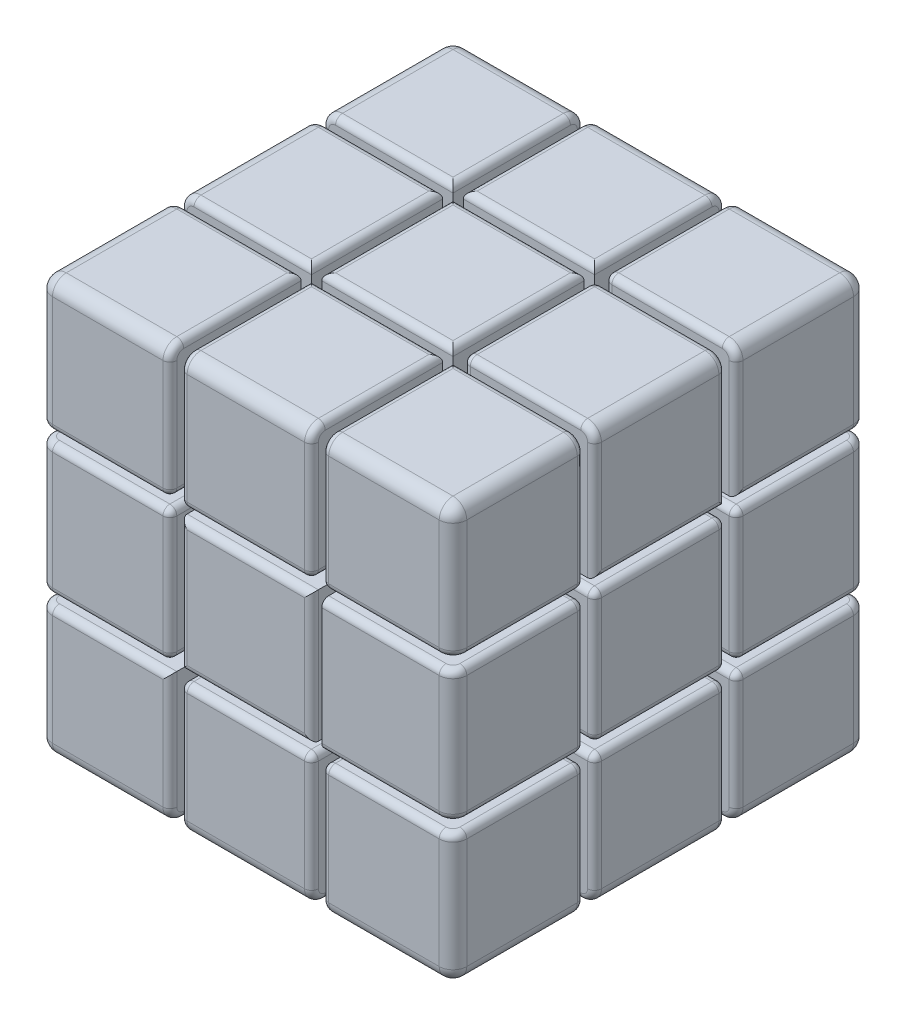
from build123d import *

# Parameters (mm, degrees)
SKETCH1_W           = 60
SKETCH1_H           = 60
BOSS_EXTRUDE1_DEPTH = 60
SKETCH2_W           = 1.5
SKETCH2_H           = 60
SKETCH2_W_2         = 60
SKETCH2_H_2         = 1.5
CUT_EXTRUDE1_DEPTH  = 60
SKETCH3_W           = 1.5
SKETCH3_H           = 60
CUT_EXTRUDE2_DEPTH  = 60
FILLET1_R           = 2
FILLET2_R           = 2
FILLET3_R           = 2
FILLET4_R           = 2
FILLET5_R           = 2
FILLET6_R           = 2
FILLET7_R           = 2
FILLET8_R           = 2
FILLET9_R           = 2
FILLET10_R          = 2
FILLET11_R          = 2
FILLET12_R          = 2
FILLET13_R          = 2
FILLET14_R          = 2
FILLET15_R          = 2
FILLET16_R          = 2
FILLET17_R          = 2
FILLET18_R          = 2
FILLET19_R          = 2
FILLET20_R          = 2
FILLET21_R          = 1
FILLET22_R          = 1
FILLET23_R          = 1
FILLET24_R          = 1
FILLET25_R          = 1
FILLET26_R          = 1
FILLET27_R          = 1
FILLET28_R          = 1
FILLET29_R          = 1
FILLET30_R          = 1
FILLET31_R          = 1
FILLET32_R          = 1
FILLET33_R          = 1
FILLET34_R          = 1
FILLET35_R          = 1
FILLET36_R          = 1
FILLET37_R          = 1
FILLET38_R          = 1
FILLET39_R          = 1
FILLET40_R          = 1
FILLET41_R          = 1
FILLET42_R          = 1
FILLET43_R          = 1
FILLET44_R          = 1
FILLET45_R          = 1
FILLET46_R          = 1
FILLET47_R          = 1
FILLET48_R          = 1
FILLET49_R          = 1
FILLET50_R          = 1
FILLET51_R          = 1
FILLET52_R          = 1
FILLET53_R          = 1
FILLET54_R          = 1
FILLET55_R          = 1
FILLET56_R          = 1
FILLET57_R          = 1
FILLET58_R          = 1
FILLET59_R          = 1
FILLET60_R          = 1
FILLET61_R          = 1
FILLET62_R          = 1
FILLET63_R          = 1
FILLET64_R          = 1
FILLET65_R          = 1
FILLET66_R          = 1
FILLET67_R          = 1
FILLET68_R          = 1
FILLET69_R          = 1
FILLET70_R          = 1
FILLET71_R          = 1
FILLET72_R          = 1
FILLET73_R          = 1


with BuildPart() as part:
    # Sketch1 → Boss-Extrude1 (new body)
    with BuildSketch(Plane(origin=(0, 0, 0), x_dir=(1, 0, 0), z_dir=(0, 1, 0))):
        Rectangle(SKETCH1_W, SKETCH1_H)
    extrude(amount=BOSS_EXTRUDE1_DEPTH)

    # Sketch2 → Cut-Extrude1 (cut)
    with BuildSketch(Plane.XY.offset(30)):
        with Locations((-10.25, 30)):
            Rectangle(SKETCH2_W, SKETCH2_H)
        with Locations((10.25, 30)):
            Rectangle(SKETCH2_W, SKETCH2_H)
        with Locations((0, 40.25)):
            Rectangle(SKETCH2_W_2, SKETCH2_H_2)
        with Locations((0, 19.75)):
            Rectangle(SKETCH2_W_2, SKETCH2_H_2)
    extrude(amount=-CUT_EXTRUDE1_DEPTH, mode=Mode.SUBTRACT)


with BuildPart() as cut_extrude1_piece_1:
    # of the separate pieces the step leaves, piece 1, a body of its own (cut_extrude1_pieces)
    add(part.part.solids().sort_by_distance((-9.5, 60, -30))[0])


with BuildPart() as cut_extrude1_piece_2:
    # of the separate pieces the step leaves, piece 2, a body of its own (cut_extrude1_pieces)
    add(part.part.solids().sort_by_distance((-9.5, 0, -30))[0])


with BuildPart() as cut_extrude1_piece_3:
    # of the separate pieces the step leaves, piece 3, a body of its own (cut_extrude1_pieces)
    add(part.part.solids().sort_by_distance((-30, 41, -30))[0])


with BuildPart() as cut_extrude1_piece_4:
    # of the separate pieces the step leaves, piece 4, a body of its own (cut_extrude1_pieces)
    add(part.part.solids().sort_by_distance((-30, 0, -30))[0])


with BuildPart() as cut_extrude1_piece_5:
    # of the separate pieces the step leaves, piece 5, a body of its own (cut_extrude1_pieces)
    add(part.part.solids().sort_by_distance((11, 60, -30))[0])


with BuildPart() as cut_extrude1_piece_6:
    # of the separate pieces the step leaves, piece 6, a body of its own (cut_extrude1_pieces)
    add(part.part.solids().sort_by_distance((-9.5, 39.5, -30))[0])


with BuildPart() as cut_extrude1_piece_7:
    # of the separate pieces the step leaves, piece 7, a body of its own (cut_extrude1_pieces)
    add(part.part.solids().sort_by_distance((11, 0, -30))[0])


with BuildPart() as cut_extrude1_piece_8:
    # of the separate pieces the step leaves, piece 8, a body of its own (cut_extrude1_pieces)
    add(part.part.solids().sort_by_distance((-30, 20.5, -30))[0])


with BuildPart() as cut_extrude1_piece_9:
    # of the separate pieces the step leaves, piece 9, a body of its own (cut_extrude1_pieces)
    add(part.part.solids().sort_by_distance((30, 20.5, -30))[0])


with BuildPart() as cut_extrude2_tool:
    # Sketch3 → Cut-Extrude2 (new body)
    with BuildSketch(Plane(origin=(30, 0, 0), x_dir=(0, 0, -1), z_dir=(1, 0, 0))):
        with Locations((-10.25, 30)):
            Rectangle(SKETCH3_W, SKETCH3_H)
        with Locations((10.25, 30)):
            Rectangle(SKETCH3_W, SKETCH3_H)
    extrude(amount=-CUT_EXTRUDE2_DEPTH)


with BuildPart() as cut_extrude1_piece_1_1:
    add(cut_extrude1_piece_1.part)

    # Cut-Extrude2: cut by cut_extrude2_tool
    add(cut_extrude2_tool.part, mode=Mode.SUBTRACT)

    # Fillet4
    fillet4_edges = [cut_extrude1_piece_1_1.edges().sort_by_distance(p)[0] for p in [
        (0, 60, 30),
    ]]
    fillet(fillet4_edges, radius=FILLET4_R)

    # Fillet20
    fillet20_edges = [cut_extrude1_piece_1_1.edges().sort_by_distance(p)[0] for p in [
        (0, 60, -30),
    ]]
    fillet(fillet20_edges, radius=FILLET20_R)

    # Fillet35
    fillet35_edges = [cut_extrude1_piece_1_1.edges().sort_by_distance(p)[0] for p in [
        (-9.5, 60, 0),
        (0, 60, -9.5),
        (9.5, 60, 0),
        (0, 60, 9.5),
    ]]
    fillet(fillet35_edges, radius=FILLET35_R)

    # Fillet38
    fillet38_edges = [cut_extrude1_piece_1_1.edges().sort_by_distance(p)[0] for p in [
        (9.5, 49.5, 30),
        (9.5, 59.414213562, 29.414213562),
        (-9.5, 49.5, 30),
        (-9.5, 59.414213562, 29.414213562),
        (9.5, 60, 19.5),
        (-9.5, 60, 19.5),
        (0, 60, 11),
    ]]
    fillet(fillet38_edges, radius=FILLET38_R)

    # Fillet42
    fillet42_edges = [cut_extrude1_piece_1_1.edges().sort_by_distance(p)[0] for p in [
        (9.5, 49.5, -30),
        (9.5, 59.414213562, -29.414213562),
        (-9.5, 49.5, -30),
        (-9.5, 59.414213562, -29.414213562),
        (9.5, 60, -19.5),
        (0, 60, -11),
        (-9.5, 60, -19.5),
    ]]
    fillet(fillet42_edges, radius=FILLET42_R)

    # Fillet50
    fillet50_edges = [cut_extrude1_piece_1_1.edges().sort_by_distance(p)[0] for p in [
        (-9.5, 41, -20),
        (-9.207106781, 41, -29.707106781),
        (9.5, 41, -20),
        (9.207106781, 41, -29.707106781),
        (0, 41, -30),
    ]]
    fillet(fillet50_edges, radius=FILLET50_R)

    # Fillet57
    fillet57_edges = [cut_extrude1_piece_1_1.edges().sort_by_distance(p)[0] for p in [
        (-9.5, 41, 20),
        (-9.207106781, 41, 29.707106781),
        (9.5, 41, 20),
        (9.207106781, 41, 29.707106781),
        (0, 41, 30),
    ]]
    fillet(fillet57_edges, radius=FILLET57_R)


with BuildPart() as cut_extrude1_piece_2_1:
    add(cut_extrude1_piece_2.part)

    # Cut-Extrude2: cut by cut_extrude2_tool
    add(cut_extrude2_tool.part, mode=Mode.SUBTRACT)

    # Fillet8
    fillet8_edges = [cut_extrude1_piece_2_1.edges().sort_by_distance(p)[0] for p in [
        (0, 0, 30),
    ]]
    fillet(fillet8_edges, radius=FILLET8_R)

    # Fillet14
    fillet14_edges = [cut_extrude1_piece_2_1.edges().sort_by_distance(p)[0] for p in [
        (0, 0, -30),
    ]]
    fillet(fillet14_edges, radius=FILLET14_R)

    # Fillet46
    fillet46_edges = [cut_extrude1_piece_2_1.edges().sort_by_distance(p)[0] for p in [
        (-9.5, 0, -19.5),
        (-9.5, 0.585786438, -29.414213562),
        (9.5, 0, -19.5),
        (9.5, 0.585786438, -29.414213562),
        (-9.5, 10.5, -30),
        (0, 19, -30),
        (9.5, 10.5, -30),
    ]]
    fillet(fillet46_edges, radius=FILLET46_R)

    # Fillet65
    fillet65_edges = [cut_extrude1_piece_2_1.edges().sort_by_distance(p)[0] for p in [
        (0, 0, -9.5),
        (-9.5, 0, 0),
        (0, 0, 9.5),
        (9.5, 0, 0),
    ]]
    fillet(fillet65_edges, radius=FILLET65_R)

    # Fillet68
    fillet68_edges = [cut_extrude1_piece_2_1.edges().sort_by_distance(p)[0] for p in [
        (-9.5, 10, -11),
        (-9.207106781, 0.292893219, -11),
        (9.5, 10, -11),
        (9.207106781, 0.292893219, -11),
        (0, 0, -11),
    ]]
    fillet(fillet68_edges, radius=FILLET68_R)

    # Fillet70
    fillet70_edges = [cut_extrude1_piece_2_1.edges().sort_by_distance(p)[0] for p in [
        (-9.5, 10.5, 30),
        (-9.5, 0.585786438, 29.414213562),
        (9.5, 10.5, 30),
        (9.5, 0.585786438, 29.414213562),
        (0, 0, 11),
        (-9.5, 0, 19.5),
        (9.5, 0, 19.5),
    ]]
    fillet(fillet70_edges, radius=FILLET70_R)

    # Fillet71
    fillet71_edges = [cut_extrude1_piece_2_1.edges().sort_by_distance(p)[0] for p in [
        (-9.5, 19, 20),
        (-9.207106781, 19, 29.707106781),
        (9.5, 19, 20),
        (9.207106781, 19, 29.707106781),
        (0, 19, 30),
    ]]
    fillet(fillet71_edges, radius=FILLET71_R)


with BuildPart() as cut_extrude1_piece_3_1:
    add(cut_extrude1_piece_3.part)

    # Cut-Extrude2: cut by cut_extrude2_tool
    add(cut_extrude2_tool.part, mode=Mode.SUBTRACT)

    # Fillet5
    fillet5_edges = [cut_extrude1_piece_3_1.edges().sort_by_distance(p)[0] for p in [
        (-30, 60, 20.5),
        (-30, 50.5, 30),
        (-20.5, 60, 30),
    ]]
    fillet(fillet5_edges, radius=FILLET5_R)

    # Fillet9
    fillet9_edges = [cut_extrude1_piece_3_1.edges().sort_by_distance(p)[0] for p in [
        (-30, 60, 0),
    ]]
    fillet(fillet9_edges, radius=FILLET9_R)

    # Fillet10
    fillet10_edges = [cut_extrude1_piece_3_1.edges().sort_by_distance(p)[0] for p in [
        (-20.5, 60, -30),
        (-30, 50.5, -30),
        (-30, 60, -20.5),
    ]]
    fillet(fillet10_edges, radius=FILLET10_R)

    # Fillet39
    fillet39_edges = [cut_extrude1_piece_3_1.edges().sort_by_distance(p)[0] for p in [
        (-30, 49.5, 11),
        (-29.414213562, 59.414213562, 11),
        (-11, 49.5, 30),
        (-11, 59.414213562, 29.414213562),
        (-19.5, 60, 11),
        (-11, 60, 19.5),
    ]]
    fillet(fillet39_edges, radius=FILLET39_R)

    # Fillet40
    fillet40_edges = [cut_extrude1_piece_3_1.edges().sort_by_distance(p)[0] for p in [
        (-30, 49.5, -9.5),
        (-29.414213562, 59.414213562, -9.5),
        (-30, 49.5, 9.5),
        (-29.414213562, 59.414213562, 9.5),
        (-19.5, 60, -9.5),
        (-19.5, 60, 9.5),
        (-11, 60, 0),
    ]]
    fillet(fillet40_edges, radius=FILLET40_R)

    # Fillet41
    fillet41_edges = [cut_extrude1_piece_3_1.edges().sort_by_distance(p)[0] for p in [
        (-30, 49.5, -11),
        (-29.414213562, 59.414213562, -11),
        (-11, 49.5, -30),
        (-11, 59.414213562, -29.414213562),
        (-19.5, 60, -11),
        (-11, 60, -19.5),
    ]]
    fillet(fillet41_edges, radius=FILLET41_R)

    # Fillet51
    fillet51_edges = [cut_extrude1_piece_3_1.edges().sort_by_distance(p)[0] for p in [
        (-20, 41, -11),
        (-29.707106781, 41, -11.292893219),
        (-30, 41, -20),
        (-29.414213562, 41, -29.414213562),
        (-11, 41, -20),
        (-11.292893219, 41, -29.707106781),
        (-20, 41, -30),
    ]]
    fillet(fillet51_edges, radius=FILLET51_R)

    # Fillet54
    fillet54_edges = [cut_extrude1_piece_3_1.edges().sort_by_distance(p)[0] for p in [
        (-20, 41, 11),
        (-29.707106781, 41, 11.292893219),
        (-30, 41, 20),
        (-29.414213562, 41, 29.414213562),
        (-11, 41, 20),
        (-11.292893219, 41, 29.707106781),
        (-20, 41, 30),
    ]]
    fillet(fillet54_edges, radius=FILLET54_R)

    # Fillet62
    fillet62_edges = [cut_extrude1_piece_3_1.edges().sort_by_distance(p)[0] for p in [
        (-20, 41, -9.5),
        (-29.707106781, 41, -9.207106781),
        (-20, 41, 9.5),
        (-29.707106781, 41, 9.207106781),
        (-30, 41, 0),
    ]]
    fillet(fillet62_edges, radius=FILLET62_R)


with BuildPart() as cut_extrude1_piece_4_1:
    add(cut_extrude1_piece_4.part)

    # Cut-Extrude2: cut by cut_extrude2_tool
    add(cut_extrude2_tool.part, mode=Mode.SUBTRACT)

    # Fillet6
    fillet6_edges = [cut_extrude1_piece_4_1.edges().sort_by_distance(p)[0] for p in [
        (-20.5, 0, 30),
        (-30, 0, 20.5),
        (-30, 9.5, 30),
    ]]
    fillet(fillet6_edges, radius=FILLET6_R)

    # Fillet12
    fillet12_edges = [cut_extrude1_piece_4_1.edges().sort_by_distance(p)[0] for p in [
        (-30, 0, -20.5),
        (-20.5, 0, -30),
        (-30, 9.5, -30),
    ]]
    fillet(fillet12_edges, radius=FILLET12_R)

    # Fillet13
    fillet13_edges = [cut_extrude1_piece_4_1.edges().sort_by_distance(p)[0] for p in [
        (-30, 0, 0),
    ]]
    fillet(fillet13_edges, radius=FILLET13_R)

    # Fillet47
    fillet47_edges = [cut_extrude1_piece_4_1.edges().sort_by_distance(p)[0] for p in [
        (-30, 19, -19.5),
        (-29.414213562, 19, -29.414213562),
        (-11, 0, -19.5),
        (-11, 0.585786438, -29.414213562),
        (-19.5, 19, -30),
        (-11, 10.5, -30),
    ]]
    fillet(fillet47_edges, radius=FILLET47_R)

    # Fillet53
    fillet53_edges = [cut_extrude1_piece_4_1.edges().sort_by_distance(p)[0] for p in [
        (-11, 0, 19.5),
        (-11, 0.585786438, 29.414213562),
        (-30, 19, 19.5),
        (-29.414213562, 19, 29.414213562),
        (-11, 10.5, 30),
        (-19.5, 19, 30),
    ]]
    fillet(fillet53_edges, radius=FILLET53_R)

    # Fillet59
    fillet59_edges = [cut_extrude1_piece_4_1.edges().sort_by_distance(p)[0] for p in [
        (-11, 10, -11),
        (-11.292893219, 0.292893219, -11),
        (-20, 0, -11),
        (-29.414213562, 0.585786438, -11),
        (-20, 19, -11),
        (-29.707106781, 18.707106781, -11),
        (-30, 10, -11),
    ]]
    fillet(fillet59_edges, radius=FILLET59_R)

    # Fillet60
    fillet60_edges = [cut_extrude1_piece_4_1.edges().sort_by_distance(p)[0] for p in [
        (-19.5, 0, 9.5),
        (-29.414213562, 0.585786438, 9.5),
        (-19.5, 0, -9.5),
        (-29.414213562, 0.585786438, -9.5),
        (-30, 19, 0),
        (-30, 10.5, 9.5),
        (-30, 10.5, -9.5),
    ]]
    fillet(fillet60_edges, radius=FILLET60_R)

    # Fillet66
    fillet66_edges = [cut_extrude1_piece_4_1.edges().sort_by_distance(p)[0] for p in [
        (-11, 10, -9.5),
        (-11, 0.292893219, -9.207106781),
        (-11, 10, 9.5),
        (-11, 0.292893219, 9.207106781),
        (-11, 0, 0),
    ]]
    fillet(fillet66_edges, radius=FILLET66_R)


with BuildPart() as cut_extrude1_piece_5_1:
    add(cut_extrude1_piece_5.part)

    # Cut-Extrude2: cut by cut_extrude2_tool
    add(cut_extrude2_tool.part, mode=Mode.SUBTRACT)

    # Fillet1
    fillet1_edges = [cut_extrude1_piece_5_1.edges().sort_by_distance(p)[0] for p in [
        (20.5, 60, 30),
        (30, 50.5, 30),
        (30, 60, 20.5),
    ]]
    fillet(fillet1_edges, radius=FILLET1_R)

    # Fillet18
    fillet18_edges = [cut_extrude1_piece_5_1.edges().sort_by_distance(p)[0] for p in [
        (30, 60, -20.5),
        (20.5, 60, -30),
        (30, 50.5, -30),
    ]]
    fillet(fillet18_edges, radius=FILLET18_R)

    # Fillet19
    fillet19_edges = [cut_extrude1_piece_5_1.edges().sort_by_distance(p)[0] for p in [
        (30, 60, 0),
    ]]
    fillet(fillet19_edges, radius=FILLET19_R)

    # Fillet33
    fillet33_edges = [cut_extrude1_piece_5_1.edges().sort_by_distance(p)[0] for p in [
        (19.5, 41, -30),
        (29.414213562, 41, -29.414213562),
        (19.5, 60, -11),
        (29.414213562, 59.414213562, -11),
        (30, 41, -19.5),
        (30, 49.5, -11),
    ]]
    fillet(fillet33_edges, radius=FILLET33_R)

    # Fillet34
    fillet34_edges = [cut_extrude1_piece_5_1.edges().sort_by_distance(p)[0] for p in [
        (19.5, 60, -9.5),
        (29.414213562, 59.414213562, -9.5),
        (19.5, 60, 9.5),
        (29.414213562, 59.414213562, 9.5),
        (30, 49.5, -9.5),
        (30, 41, 0),
        (30, 49.5, 9.5),
    ]]
    fillet(fillet34_edges, radius=FILLET34_R)

    # Fillet36
    fillet36_edges = [cut_extrude1_piece_5_1.edges().sort_by_distance(p)[0] for p in [
        (11, 50, -9.5),
        (11, 59.707106781, -9.207106781),
        (11, 50, 9.5),
        (11, 59.707106781, 9.207106781),
        (11, 60, 0),
    ]]
    fillet(fillet36_edges, radius=FILLET36_R)

    # Fillet37
    fillet37_edges = [cut_extrude1_piece_5_1.edges().sort_by_distance(p)[0] for p in [
        (30, 49.5, 11),
        (29.414213562, 59.414213562, 11),
        (11, 49.5, 30),
        (11, 59.414213562, 29.414213562),
        (19.5, 60, 11),
        (11, 60, 19.5),
    ]]
    fillet(fillet37_edges, radius=FILLET37_R)

    # Fillet43
    fillet43_edges = [cut_extrude1_piece_5_1.edges().sort_by_distance(p)[0] for p in [
        (11, 41, -20),
        (11, 41.292893219, -29.707106781),
        (11, 50, -30),
        (11, 59.414213562, -29.414213562),
        (11, 50, -11),
        (11, 59.707106781, -11.292893219),
        (11, 60, -20),
    ]]
    fillet(fillet43_edges, radius=FILLET43_R)

    # Fillet52
    fillet52_edges = [cut_extrude1_piece_5_1.edges().sort_by_distance(p)[0] for p in [
        (20, 41, 11),
        (29.707106781, 41, 11.292893219),
        (11, 41, 20),
        (11.292893219, 41, 29.707106781),
        (20, 41, 30),
        (29.414213562, 41, 29.414213562),
        (30, 41, 20),
    ]]
    fillet(fillet52_edges, radius=FILLET52_R)


with BuildPart() as cut_extrude1_piece_6_1:
    add(cut_extrude1_piece_6.part)

    # Cut-Extrude2: cut by cut_extrude2_tool
    add(cut_extrude2_tool.part, mode=Mode.SUBTRACT)

    # Fillet49
    fillet49_edges = [cut_extrude1_piece_6_1.edges().sort_by_distance(p)[0] for p in [
        (0, 39.5, -30),
        (-9.5, 30, -30),
        (0, 20.5, -30),
        (9.5, 30, -30),
    ]]
    fillet(fillet49_edges, radius=FILLET49_R)

    # Fillet55
    fillet55_edges = [cut_extrude1_piece_6_1.edges().sort_by_distance(p)[0] for p in [
        (0, 39.5, 30),
        (9.5, 30, 30),
        (0, 20.5, 30),
        (-9.5, 30, 30),
    ]]
    fillet(fillet55_edges, radius=FILLET55_R)


with BuildPart() as cut_extrude1_piece_7_1:
    add(cut_extrude1_piece_7.part)

    # Cut-Extrude2: cut by cut_extrude2_tool
    add(cut_extrude2_tool.part, mode=Mode.SUBTRACT)

    # Fillet2
    fillet2_edges = [cut_extrude1_piece_7_1.edges().sort_by_distance(p)[0] for p in [
        (30, 0, 20.5),
        (20.5, 0, 30),
        (30, 9.5, 30),
    ]]
    fillet(fillet2_edges, radius=FILLET2_R)

    # Fillet15
    fillet15_edges = [cut_extrude1_piece_7_1.edges().sort_by_distance(p)[0] for p in [
        (30, 9.5, -30),
        (30, 0, -20.5),
        (20.5, 0, -30),
    ]]
    fillet(fillet15_edges, radius=FILLET15_R)

    # Fillet16
    fillet16_edges = [cut_extrude1_piece_7_1.edges().sort_by_distance(p)[0] for p in [
        (30, 0, 0),
    ]]
    fillet(fillet16_edges, radius=FILLET16_R)

    # Fillet21
    fillet21_edges = [cut_extrude1_piece_7_1.edges().sort_by_distance(p)[0] for p in [
        (19.5, 19, 30),
        (29.414213562, 19, 29.414213562),
        (30, 19, 19.5),
    ]]
    fillet(fillet21_edges, radius=FILLET21_R)

    # Fillet22
    fillet22_edges = [cut_extrude1_piece_7_1.edges().sort_by_distance(p)[0] for p in [
        (30, 19, 0),
    ]]
    fillet(fillet22_edges, radius=FILLET22_R)

    # Fillet32
    fillet32_edges = [cut_extrude1_piece_7_1.edges().sort_by_distance(p)[0] for p in [
        (19.5, 19, -30),
        (29.414213562, 19, -29.414213562),
        (30, 19, -19.5),
    ]]
    fillet(fillet32_edges, radius=FILLET32_R)

    # Fillet45
    fillet45_edges = [cut_extrude1_piece_7_1.edges().sort_by_distance(p)[0] for p in [
        (11, 19, -20),
        (11, 18.707106781, -29.707106781),
        (11, 0, -19.5),
        (11, 0.585786438, -29.414213562),
        (11, 10, -30),
    ]]
    fillet(fillet45_edges, radius=FILLET45_R)

    # Fillet64
    fillet64_edges = [cut_extrude1_piece_7_1.edges().sort_by_distance(p)[0] for p in [
        (20, 19, 9.5),
        (29.707106781, 18.707106781, 9.5),
        (30, 10, 9.5),
        (29.414213562, 0.585786438, 9.5),
        (20, 19, -9.5),
        (29.707106781, 18.707106781, -9.5),
        (30, 10, -9.5),
        (29.414213562, 0.585786438, -9.5),
        (11, 0, 0),
        (19.5, 0, 9.5),
        (19.5, 0, -9.5),
    ]]
    fillet(fillet64_edges, radius=FILLET64_R)

    # Fillet67
    fillet67_edges = [cut_extrude1_piece_7_1.edges().sort_by_distance(p)[0] for p in [
        (11.292893219, 0.292893219, -11),
        (11, 9.5, -11),
        (11.292893219, 18.707106781, -11),
        (20.5, 19, -11),
        (29.707106781, 18.707106781, -11),
        (30, 10, -11),
        (29.414213562, 0.585786438, -11),
        (20, 0, -11),
    ]]
    fillet(fillet67_edges, radius=FILLET67_R)

    # Fillet69
    fillet69_edges = [cut_extrude1_piece_7_1.edges().sort_by_distance(p)[0] for p in [
        (11, 19, 20),
        (11, 18.707106781, 29.707106781),
        (11, 10, 30),
        (11, 0.585786438, 29.414213562),
        (20, 19, 11),
        (29.707106781, 18.707106781, 11),
        (30, 10, 11),
        (29.414213562, 0.585786438, 11),
        (11, 0, 19.5),
        (19.5, 0, 11),
    ]]
    fillet(fillet69_edges, radius=FILLET69_R)


with BuildPart() as cut_extrude1_piece_8_1:
    add(cut_extrude1_piece_8.part)

    # Cut-Extrude2: cut by cut_extrude2_tool
    add(cut_extrude2_tool.part, mode=Mode.SUBTRACT)

    # Fillet7
    fillet7_edges = [cut_extrude1_piece_8_1.edges().sort_by_distance(p)[0] for p in [
        (-30, 30, 30),
    ]]
    fillet(fillet7_edges, radius=FILLET7_R)

    # Fillet11
    fillet11_edges = [cut_extrude1_piece_8_1.edges().sort_by_distance(p)[0] for p in [
        (-30, 30, -30),
    ]]
    fillet(fillet11_edges, radius=FILLET11_R)

    # Fillet48
    fillet48_edges = [cut_extrude1_piece_8_1.edges().sort_by_distance(p)[0] for p in [
        (-30, 39.5, -19.5),
        (-29.414213562, 39.5, -29.414213562),
        (-30, 20.5, -19.5),
        (-29.414213562, 20.5, -29.414213562),
        (-19.5, 39.5, -30),
        (-11, 30, -30),
        (-19.5, 20.5, -30),
    ]]
    fillet(fillet48_edges, radius=FILLET48_R)

    # Fillet56
    fillet56_edges = [cut_extrude1_piece_8_1.edges().sort_by_distance(p)[0] for p in [
        (-30, 39.5, 19.5),
        (-29.414213562, 39.5, 29.414213562),
        (-30, 20.5, 19.5),
        (-29.414213562, 20.5, 29.414213562),
        (-19.5, 39.5, 30),
        (-19.5, 20.5, 30),
    ]]
    fillet(fillet56_edges, radius=FILLET56_R)

    # Fillet58
    fillet58_edges = [cut_extrude1_piece_8_1.edges().sort_by_distance(p)[0] for p in [
        (-20, 20.5, -11),
        (-29.707106781, 20.792893219, -11),
        (-20, 39.5, -11),
        (-29.707106781, 39.207106781, -11),
        (-30, 30, -11),
    ]]
    fillet(fillet58_edges, radius=FILLET58_R)

    # Fillet61
    fillet61_edges = [cut_extrude1_piece_8_1.edges().sort_by_distance(p)[0] for p in [
        (-30, 30, -9.5),
        (-30, 39.5, 0),
        (-30, 30, 9.5),
        (-30, 20.5, 0),
    ]]
    fillet(fillet61_edges, radius=FILLET61_R)

    # Fillet63
    fillet63_edges = [cut_extrude1_piece_8_1.edges().sort_by_distance(p)[0] for p in [
        (-20, 39.5, 11),
        (-29.707106781, 39.207106781, 11),
        (-20, 20.5, 11),
        (-29.707106781, 20.792893219, 11),
        (-30, 30, 11),
    ]]
    fillet(fillet63_edges, radius=FILLET63_R)

    # Fillet73
    fillet73_edges = [cut_extrude1_piece_8_1.edges().sort_by_distance(p)[0] for p in [
        (-11, 39.207106781, 29.707106781),
        (-11, 39.5, 20.5),
        (-11, 39.207106781, 11.292893219),
        (-11, 30, 11),
        (-11, 20.792893219, 11.292893219),
        (-11, 20.5, 20.5),
        (-11, 20.792893219, 29.707106781),
        (-11, 30, 30),
    ]]
    fillet(fillet73_edges, radius=FILLET73_R)


with BuildPart() as cut_extrude1_piece_9_1:
    add(cut_extrude1_piece_9.part)

    # Cut-Extrude2: cut by cut_extrude2_tool
    add(cut_extrude2_tool.part, mode=Mode.SUBTRACT)

    # Fillet3
    fillet3_edges = [cut_extrude1_piece_9_1.edges().sort_by_distance(p)[0] for p in [
        (30, 30, 30),
    ]]
    fillet(fillet3_edges, radius=FILLET3_R)

    # Fillet17
    fillet17_edges = [cut_extrude1_piece_9_1.edges().sort_by_distance(p)[0] for p in [
        (30, 30, -30),
    ]]
    fillet(fillet17_edges, radius=FILLET17_R)

    # Fillet23
    fillet23_edges = [cut_extrude1_piece_9_1.edges().sort_by_distance(p)[0] for p in [
        (19.5, 39.5, 30),
        (29.414213562, 39.5, 29.414213562),
        (30, 39.5, 19.5),
    ]]
    fillet(fillet23_edges, radius=FILLET23_R)

    # Fillet24
    fillet24_edges = [cut_extrude1_piece_9_1.edges().sort_by_distance(p)[0] for p in [
        (30, 39.5, 0),
    ]]
    fillet(fillet24_edges, radius=FILLET24_R)

    # Fillet25
    fillet25_edges = [cut_extrude1_piece_9_1.edges().sort_by_distance(p)[0] for p in [
        (19.5, 39.5, -30),
        (29.414213562, 39.5, -29.414213562),
        (30, 39.5, -19.5),
    ]]
    fillet(fillet25_edges, radius=FILLET25_R)

    # Fillet26
    fillet26_edges = [cut_extrude1_piece_9_1.edges().sort_by_distance(p)[0] for p in [
        (20, 39.5, -11),
        (29.707106781, 39.207106781, -11),
        (30, 29.5, -11),
    ]]
    fillet(fillet26_edges, radius=FILLET26_R)

    # Fillet27
    fillet27_edges = [cut_extrude1_piece_9_1.edges().sort_by_distance(p)[0] for p in [
        (20, 39.5, 9.5),
        (29.707106781, 39.207106781, 9.5),
        (30, 29.5, 9.5),
    ]]
    fillet(fillet27_edges, radius=FILLET27_R)

    # Fillet28
    fillet28_edges = [cut_extrude1_piece_9_1.edges().sort_by_distance(p)[0] for p in [
        (20, 39.5, 11),
        (29.707106781, 39.207106781, 11),
        (30, 29.5, 11),
    ]]
    fillet(fillet28_edges, radius=FILLET28_R)

    # Fillet29
    fillet29_edges = [cut_extrude1_piece_9_1.edges().sort_by_distance(p)[0] for p in [
        (20, 20.5, 11),
        (29.707106781, 20.5, 11.292893219),
        (19.5, 20.5, 30),
        (29.414213562, 20.5, 29.414213562),
        (30, 20.5, 20),
    ]]
    fillet(fillet29_edges, radius=FILLET29_R)

    # Fillet30
    fillet30_edges = [cut_extrude1_piece_9_1.edges().sort_by_distance(p)[0] for p in [
        (20, 20.5, 9.5),
        (29.707106781, 20.5, 9.207106781),
        (30, 20.5, -0.5),
    ]]
    fillet(fillet30_edges, radius=FILLET30_R)

    # Fillet31
    fillet31_edges = [cut_extrude1_piece_9_1.edges().sort_by_distance(p)[0] for p in [
        (19.5, 20.5, -30),
        (29.414213562, 20.5, -29.414213562),
        (20, 20.5, -11),
        (29.707106781, 20.5, -11.292893219),
        (30, 20.5, -20),
    ]]
    fillet(fillet31_edges, radius=FILLET31_R)

    # Fillet44
    fillet44_edges = [cut_extrude1_piece_9_1.edges().sort_by_distance(p)[0] for p in [
        (11, 39.207106781, -29.707106781),
        (11, 39.5, -20.5),
        (11, 39.207106781, -11.292893219),
        (11, 30, -11),
        (11, 20.792893219, -11.292893219),
        (11, 20.5, -20.5),
        (11, 20.792893219, -29.707106781),
        (11, 30, -30),
    ]]
    fillet(fillet44_edges, radius=FILLET44_R)

    # Fillet72
    fillet72_edges = [cut_extrude1_piece_9_1.edges().sort_by_distance(p)[0] for p in [
        (20, 39.5, -9.5),
        (29.707106781, 39.207106781, -9.5),
        (20, 20.5, -9.5),
        (29.707106781, 20.792893219, -9.5),
        (30, 30, -9.5),
    ]]
    fillet(fillet72_edges, radius=FILLET72_R)


solid = Compound([cut_extrude1_piece_1_1.part, cut_extrude1_piece_2_1.part, cut_extrude1_piece_3_1.part, cut_extrude1_piece_4_1.part, cut_extrude1_piece_5_1.part, cut_extrude1_piece_6_1.part, cut_extrude1_piece_7_1.part, cut_extrude1_piece_8_1.part, cut_extrude1_piece_9_1.part])
